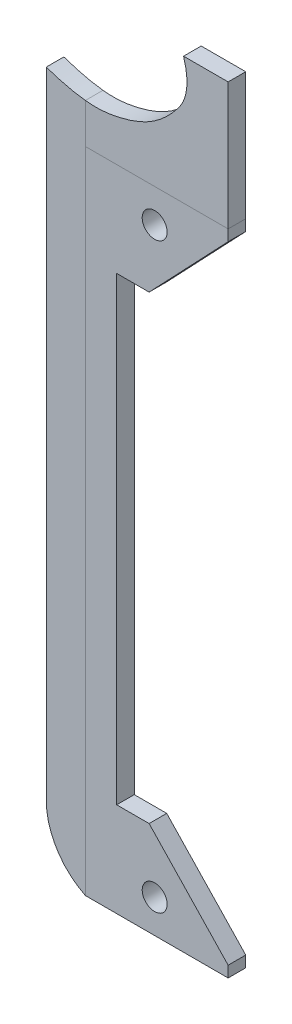
from build123d import *

# Parameters (mm, degrees)
F_3DSKETCH1_R         = 2.25
BOSS_EXTRUDE1_DEPTH   = 3.175
BOSS_EXTRUDE1_2_DEPTH = 3.175
BOSS_EXTRUDE1_3_DEPTH = 3.175
CUT_EXTRUDE1_DEPTH    = 6.858
FILLET1_R             = 12.7


with BuildPart() as part:
    # 3DSketch1 → Boss-Extrude1 (new body)
    with BuildSketch(Plane(origin=(-464.25, 116.5, 0), x_dir=(-0.2742793236442644, -0.961650067655197, 0), z_dir=(0, 0, -1))):
        Polygon((-1.923300135, 0.548558647), (0, 0), (18.333231377, 9.589323609), (19.93776542, 15.214976505), (99.754721035, -7.550207357), (98.150186992, -13.175860253), (108.666457645, -30.993563572), (110.58975778, -31.542122219), (117.652450364, -6.779632977), (5.139392449, 25.311047889), align=None)
        with Locations(Location((108.454058413, -17.154582881, 0), (0, 0, 254.080928829))):
            Circle(F_3DSKETCH1_R, mode=Mode.SUBTRACT)
        with Locations(Location((7.480801309, 11.644746102, 0), (0, 0, 254.080928829))):
            Circle(F_3DSKETCH1_R, mode=Mode.SUBTRACT)
    extrude(amount=-BOSS_EXTRUDE1_DEPTH)


with BuildPart() as body_2:
    # 3DSketch1 → Boss-Extrude1 2 (new body)
    with BuildSketch(Plane(origin=(-464.25, 116.5, 0), x_dir=(-0.2742793236442644, -0.961650067655197, 0), z_dir=(0, 0, -1))):
        Polygon((-24.002556771, 6.845946627), (-1.923300135, 0.548558647), (5.139392449, 25.311047889), (-16.939864187, 31.608435869), align=None)
    extrude(amount=-BOSS_EXTRUDE1_2_DEPTH)


with BuildPart() as body_3:
    # 3DSketch1 → Boss-Extrude1 3 (new body)
    with BuildSketch(Plane(origin=(-464.25, 116.5, 0), x_dir=(-0.2742793236442644, -0.961650067655197, 0), z_dir=(0, 0, -1))):
        Polygon((-16.939864187, 31.608435869), (5.139392449, 25.311047889), (117.652450364, -6.779632977), (119.586119596, 0), (-15.006194955, 38.388068846), align=None)
    extrude(amount=-BOSS_EXTRUDE1_3_DEPTH)


with BuildPart() as cut_extrude1_tool:
    # Sketch1 → Cut-Extrude1 (new body)
    with BuildSketch(Plane(origin=(0, 0, 0), x_dir=(-1, 0, 0), z_dir=(0, 0, -1))):
        with BuildLine():
            Line((472.286101812, 141.459761953), (497.05, 141.459761953))
            Line((497.05, 141.459761953), (497.05, 127.374197193))
            add(Edge.make_bspline(
                [(472.286101812, 141.459761953), (471.839311888, 139.996705849), (471.446482376, 137.63307279), (472.167376182, 134.273923046), (473.819960888, 132.089102365), (476.035631474, 129.726261313), (478.913541328, 127.696041036), (482.87198304, 126.231214629), (488.965357723, 125.016223815), (493.945609682, 126.32208958), (497.05, 127.374197193)],
                knots=[0, 0, 0, 0, 0.129736075, 0.200847285, 0.285412729, 0.358404023, 0.477149408, 0.580374686, 0.71621499, 1, 1, 1, 1], degree=3))
        make_face()
    extrude(amount=-CUT_EXTRUDE1_DEPTH)


with BuildPart() as body_2_1:
    add(body_2.part)

    # Cut-Extrude1: cut by cut_extrude1_tool
    add(cut_extrude1_tool.part, mode=Mode.SUBTRACT)


with BuildPart() as body_3_1:
    add(body_3.part)

    # Cut-Extrude1: cut by cut_extrude1_tool
    add(cut_extrude1_tool.part, mode=Mode.SUBTRACT)

    # Fillet1
    # the kernel refuses this fillet: 12.7 mm, written as the material it takes off along each edge
    with BuildSketch(Plane(origin=(-497.05, 1.5, -28.434958678), x_dir=(0, 1, 0), z_dir=(0, 0, 1))) as fillet1_piece_1:
        with BuildLine():
            CenterArc((11.373983471, -12.7), FILLET1_R, 90, 63.584217644)
            Line((0, -7.05), (-0.227479669, -6.937))
            ThreePointArc((-0.227479669, -6.937), (-0.254, -3.525), (-0.254, 0))
            Line((-0.254, 0), (0, 0.254))
            Line((0, 0.254), (11.373983471, 0.254))
            Line((11.373983471, 0.254), (11.373983471, 0))
        make_face()
    extrude(amount=60.044917355, mode=Mode.SUBTRACT)


solid = Compound([part.part, body_2_1.part, body_3_1.part])
